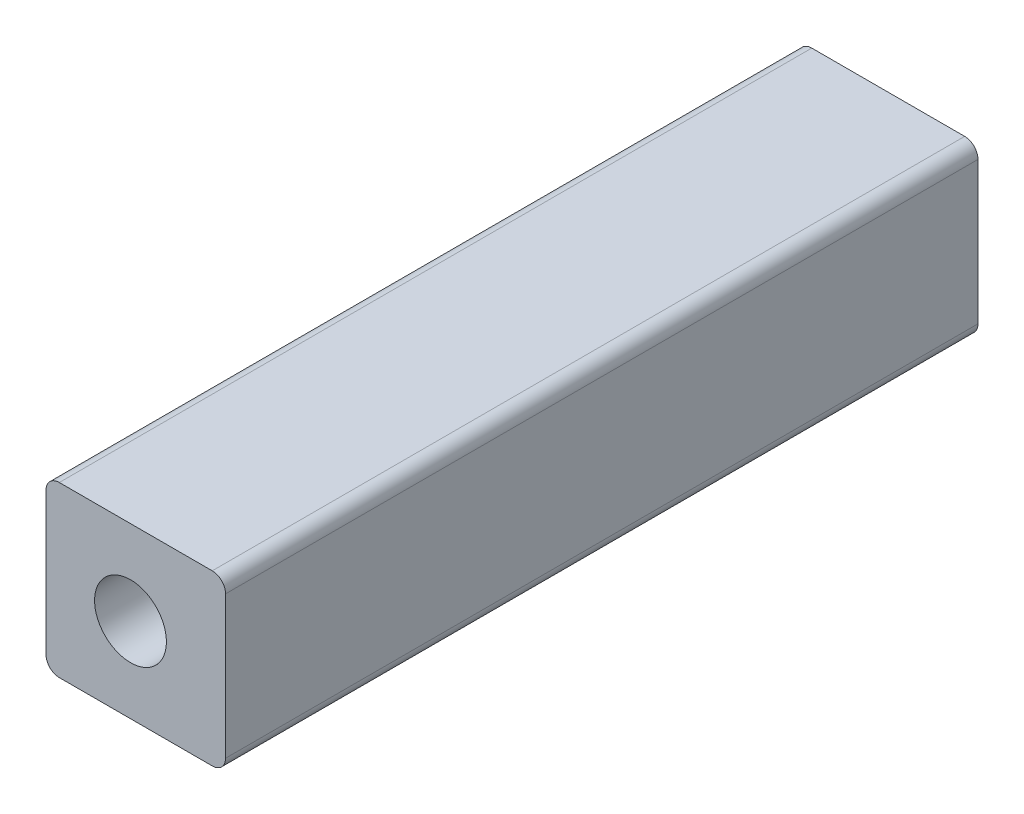
from build123d import *

# Parameters (mm, degrees)
SKETCH1_W           = 12.7
SKETCH1_H           = 12.7
SKETCH1_R           = 2.7
BOSS_EXTRUDE1_DEPTH = 28.275
SKETCH4_W           = 56.55
SKETCH4_H           = 12.7
BOSS_EXTRUDE3_DEPTH = 0.79375
FILLET2_R           = 1


with BuildPart() as part:
    # Sketch1 → Boss-Extrude1 (new, symmetric)
    with BuildSketch(Plane.XY):
        Rectangle(SKETCH1_W, SKETCH1_H)
        Circle(SKETCH1_R, mode=Mode.SUBTRACT)
    extrude(amount=BOSS_EXTRUDE1_DEPTH, both=True)

    # Sketch4 → Boss-Extrude3 (add)
    with BuildSketch(Plane(origin=(6.35, 0, 0), x_dir=(0, 0, -1), z_dir=(1, 0, 0))):
        Rectangle(SKETCH4_W, SKETCH4_H)
    extrude(amount=BOSS_EXTRUDE3_DEPTH)

    # Fillet2
    fillet2_edges = [part.edges().sort_by_distance(p)[0] for p in [
        (-6.35, -6.35, 0),
        (-6.35, 6.35, 0),
        (7.14375, 6.35, 0),
        (7.14375, -6.35, 0),
    ]]
    fillet(fillet2_edges, radius=FILLET2_R)


solid = part.part
